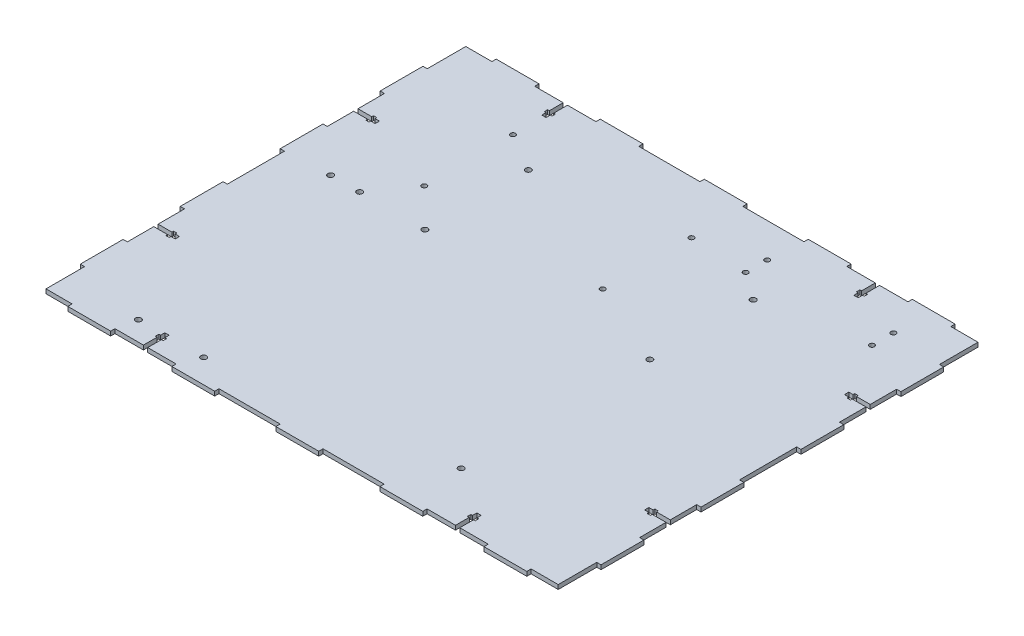
from build123d import *

# Parameters (mm, degrees)
SKETCH1_R              = 2
BOSS_EXTRUDE1_DEPTH    = 3
CUT_EXTRUDE1_OUTLINE_R = 1.75
CUT_EXTRUDE1_DEPTH     = 3


# Read off the part's stored shape, not the designer's step: Cut-Extrude1
with BuildPart() as part:
    # Sketch1 → Boss-Extrude1 (new body)
    with BuildSketch(Plane(origin=(0, 0, 0), x_dir=(1, 0, 0), z_dir=(0, 1, 0))):
        Polygon((358.721428571, -1e-09), (339.721428571, -1e-09), (339.721428571, -3.000000001), (309.721428571, -3.000000001), (309.721428571, -1e-09), (289.792857143, -1e-09), (289.792857143, 9.629999999), (290.992683898, 9.609609881), (290.992683898, 11.999999999), (289.792683898, 11.999999999), (289.792683898, 14.999999999), (286.792683898, 14.999999999), (286.792683898, 11.999999999), (285.592683898, 11.999999999), (285.592683898, 9.629999999), (286.792683898, 9.629999999), (286.792683898, -1e-09), (266.86411247, -1e-09), (266.86411247, -3.000000001), (236.86411247, -3.000000001), (236.86411247, -1e-09), (194.006969613, -1e-09), (194.006969613, -3.000000001), (164.006969613, -3.000000001), (164.006969613, -1e-09), (144.078398184, -1e-09), (141.078398184, -1e-09), (121.149826755, -1e-09), (121.149826755, -3.000000001), (91.149826755, -3.000000001), (91.149826755, -1e-09), (71.219826755, -1e-09), (71.22, 9.63), (72.42, 9.63), (72.42, 12), (71.22, 12), (71.22, 15), (68.22, 15), (68.22, 12), (67.02, 12), (67.02, 9.63), (68.219826755, 9.629999999), (68.219826755, -1e-09), (48.289826755, -1e-09), (48.289826755, -3.000000001), (18.289826755, -3.000000001), (18.289826755, -1e-09), (-0.000173245, -1e-09), (-0.000173245, 26.999999999), (-3.000173245, 26.999999999), (-3.000173245, 56.999999999), (-0.000173245, 56.999999999), (-0.000173245, 75.499999999), (9.63, 75.499999999), (9.63, 74.3), (12, 74.3), (12, 75.5), (15, 75.5), (15, 78.5), (12, 78.5), (12, 79.7), (9.63, 79.7), (9.63, 78.5), (0, 78.5), (0, 97), (-3, 97), (-3, 127), (0, 127), (0, 167), (-3, 167), (-3, 197), (0, 197), (0, 215.5), (9.63, 215.5), (9.63, 214.3), (12, 214.3), (12, 215.5), (15, 215.5), (15, 218.5), (12, 218.5), (12, 219.7), (9.63, 219.7), (9.63, 218.500000001), (-0.000173245, 218.500000001), (-0.000173245, 237.000000001), (-3.000173245, 237.000000001), (-3.000173245, 267.000000001), (-0.000173245, 267.000000001), (-0.000173245, 294.000000001), (18.289826755, 294.000000001), (18.289826755, 297.000000001), (48.289826755, 297.000000001), (48.289826755, 294.000000001), (68.219826755, 294.000000001), (68.219826755, 284.370000001), (67.02, 284.37), (67.02, 282), (68.22, 282), (68.22, 279), (71.22, 279), (71.22, 282), (72.42, 282), (72.42, 284.37), (71.22, 284.37), (71.219826755, 294.000000001), (91.149826755, 294.000000001), (91.149826755, 297.000000001), (121.149826755, 297.000000001), (121.149826755, 294.000000001), (141.078398184, 294.000000001), (144.078398184, 294.000000001), (164.006969613, 294.000000001), (164.006969613, 297.000000001), (194.006969613, 297.000000001), (194.006969613, 294.000000001), (236.86411247, 294.000000001), (236.86411247, 297.000000001), (266.86411247, 297.000000001), (266.86411247, 294.000000001), (286.792683898, 294.000000001), (286.792683898, 284.370000001), (285.592683898, 284.370000001), (285.592683898, 282.000000001), (286.792683898, 282.000000001), (286.792683898, 279.000000001), (289.792683898, 279.000000001), (289.792683898, 282.000000001), (290.992683898, 282.000000001), (290.992683898, 284.390390119), (289.792857143, 284.370000001), (289.792857143, 294.000000001), (309.721428571, 294.000000001), (309.721428571, 297.000000001), (339.721428571, 297.000000001), (339.721428571, 294.000000001), (358.721428571, 294.000000001), (358.721428571, 267), (361.721428571, 267), (361.721428571, 237), (358.721428571, 237), (358.721428571, 218.5), (349.091428571, 218.5), (349.091428571, 219.7), (346.721428571, 219.7), (346.721428571, 218.5), (343.721428571, 218.5), (343.721428571, 215.5), (346.721428571, 215.5), (346.721428571, 214.3), (349.091428571, 214.3), (349.091428571, 215.5), (358.721428571, 215.5), (358.721428571, 197), (361.721428571, 197), (361.721428571, 167), (358.721428571, 167), (358.721428571, 127), (361.721428571, 127), (361.721428571, 97), (358.721428571, 97), (358.721428571, 78.5), (349.091428571, 78.5), (349.091428571, 79.7), (346.721428571, 79.7), (346.721428571, 78.5), (343.721428571, 78.5), (343.721428571, 75.5), (346.721428571, 75.5), (346.721428571, 74.3), (349.091428571, 74.3), (349.091428571, 75.5), (358.721428571, 75.5), (358.721428571, 57), (361.721428571, 57), (361.721428571, 27), (358.721428571, 27), align=None)
        with Locations(Location((254.251428571, 240.989999999, 0), (0, 0, 270))):
            Circle(SKETCH1_R, mode=Mode.SUBTRACT)
        with Locations(Location((96.771428571, 240.989999999, 0), (0, 0, 270))):
            Circle(SKETCH1_R, mode=Mode.SUBTRACT)
        with Locations(Location((254.251428571, 36.519999999, 0), (0, 0, 270))):
            Circle(SKETCH1_R, mode=Mode.SUBTRACT)
        with Locations(Location((96.771428571, 13.659999999, 0), (0, 0, 270))):
            Circle(SKETCH1_R, mode=Mode.SUBTRACT)
        with Locations(Location((51.051428571, 13.659999999, 0), (0, 0, 270))):
            Circle(SKETCH1_R, mode=Mode.SUBTRACT)
        with Locations(Location((30.731428571, 168.599999999, 0), (0, 0, 270))):
            Circle(SKETCH1_R, mode=Mode.SUBTRACT)
        with Locations(Location((51.051428571, 168.599999999, 0), (0, 0, 270))):
            Circle(SKETCH1_R, mode=Mode.SUBTRACT)
        with Locations(Location((96.771428571, 168.599999999, 0), (0, 0, 270))):
            Circle(SKETCH1_R, mode=Mode.SUBTRACT)
        with Locations(Location((254.251428571, 168.599999999, 0), (0, 0, 270))):
            Circle(SKETCH1_R, mode=Mode.SUBTRACT)
    extrude(amount=BOSS_EXTRUDE1_DEPTH)

    # Cut-Extrude1 outline → Cut-Extrude1 (cut)
    with BuildSketch(Plane(origin=(0, 0, 0), x_dir=(1, 0, 0), z_dir=(0, 1, 0))):
        with Locations((323.449826755, 255.000000001)):
            Circle(CUT_EXTRUDE1_OUTLINE_R)
        with Locations((69.999826755, 257)):
            Circle(CUT_EXTRUDE1_OUTLINE_R)
        with Locations((69.999826755, 194.9)):
            Circle(CUT_EXTRUDE1_OUTLINE_R)
        with Locations((194.999826755, 194.9)):
            Circle(CUT_EXTRUDE1_OUTLINE_R)
        with Locations((323.449826755, 270.000000001)):
            Circle(CUT_EXTRUDE1_OUTLINE_R)
        with Locations((234.999826755, 255.000000001)):
            Circle(CUT_EXTRUDE1_OUTLINE_R)
        with Locations((234.999826755, 270.000000001)):
            Circle(CUT_EXTRUDE1_OUTLINE_R)
        with Locations((194.999826755, 257)):
            Circle(CUT_EXTRUDE1_OUTLINE_R)
    extrude(amount=CUT_EXTRUDE1_DEPTH, mode=Mode.SUBTRACT)


solid = part.part
